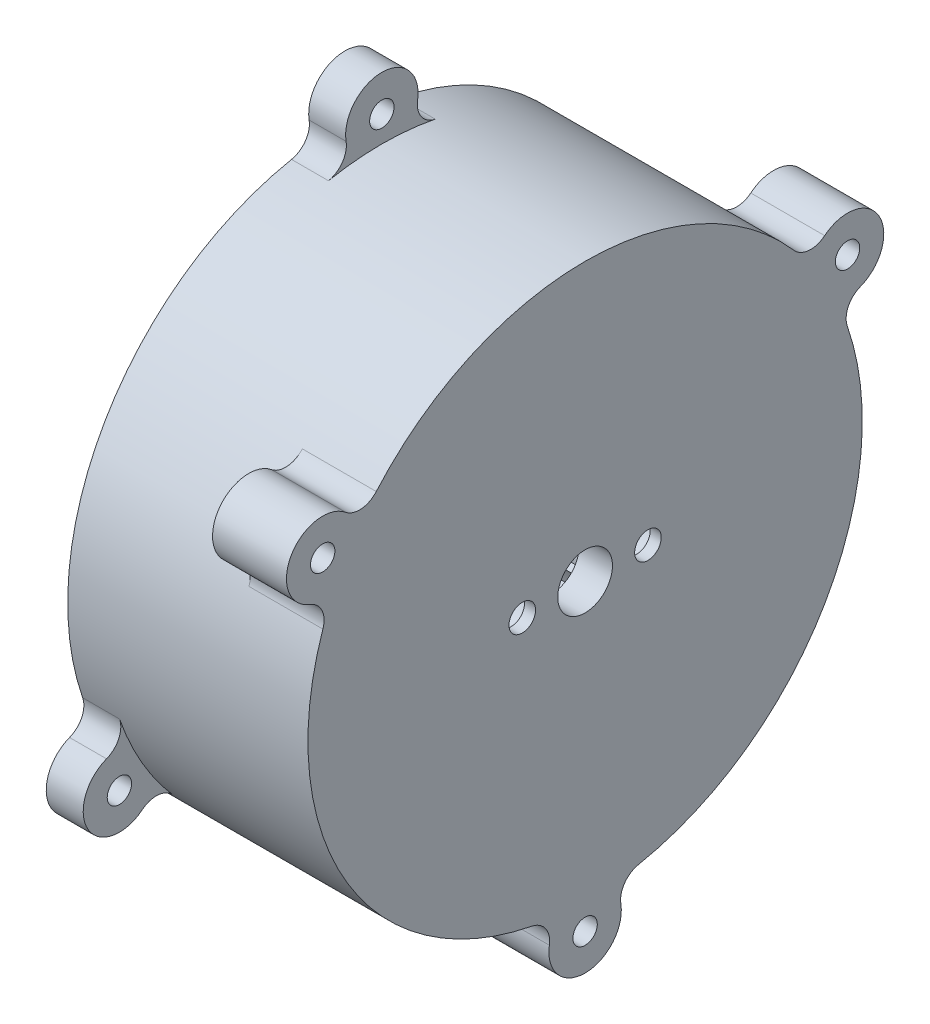
from build123d import *

# Parameters (mm, degrees)
BASPROSKE_W         = 28
BASPROSKE_H         = 4.375
TOOTHCUT_DEPTH      = 60.970826241
TEETHCUTS_COUNT     = 55
TEETHCUTS_ANGLE     = 353.454545455
BOSS_EXTRUDE1_START = 4.5
SKETCH1_R           = 37.5
BOSS_EXTRUDE1_DEPTH = 4.5
SKETCH2_R           = 3.7
SKETCH2_R_2         = 1.8
CUT_EXTRUDE1_DEPTH  = 4.5
SKETCH3_R           = 3.25
CUT_EXTRUDE2_DEPTH  = 3
BOSS_EXTRUDE2_START = -5
SKETCH4_R           = 1.65
BOSS_EXTRUDE2_DEPTH = 5
FILLET1_R           = 3
SKETCH5_R           = 1.65
BOSS_EXTRUDE3_DEPTH = 10
FILLET2_R           = 3


with BuildPart() as part:
    # BasProSke → Base-Revolve (revolve)
    with BuildSketch(Plane(origin=(0, 0, 0), x_dir=(1, 0, 0), z_dir=(0, 1, 0))):
        with Locations((14, 35.3125)):
            Rectangle(BASPROSKE_W, BASPROSKE_H)
    revolve(axis=Axis((-10, 0, 0), (1, 0, 0)))

    # TooCutSke → ToothCut (cut, through all)
    with BuildSketch(Plane(origin=(0, 0, 0), x_dir=(0, 0, -1), z_dir=(1, 0, 0))):
        with BuildLine():
            ThreePointArc((1.451447951, 33.067761022), (1.040603726, 34.522224287), (0.503573985, 35.934971761))
            ThreePointArc((0.503573985, 35.934971761), (0, 35.9385), (-0.503573985, 35.934971761))
            ThreePointArc((-0.503573985, 35.934971761), (-1.040603726, 34.522224287), (-1.451447951, 33.067761022))
            ThreePointArc((-1.451447951, 33.067761022), (0, 33.0996), (1.451447951, 33.067761022))
        make_face()
    toothcut = extrude(amount=TOOTHCUT_DEPTH, mode=Mode.SUBTRACT)

    # TeethCuts: ToothCut ×55 about axis
    teethcuts_axis = Axis((-10, 0, 0), (1, 0, 0))
    for i in range(1, TEETHCUTS_COUNT):
        add(toothcut.rotate(teethcuts_axis, i * TEETHCUTS_ANGLE / (TEETHCUTS_COUNT - 1)), mode=Mode.SUBTRACT)

    # Sketch1 → Boss-Extrude1 (add)
    with BuildSketch(Plane(origin=(28, 0, 0), x_dir=(0, 0, -1), z_dir=(1, 0, 0)).offset(BOSS_EXTRUDE1_START)):
        Circle(SKETCH1_R)
    extrude(amount=-BOSS_EXTRUDE1_DEPTH)

    # Sketch2 → Cut-Extrude1 (cut)
    with BuildSketch(Plane(origin=(32.5, 0, 0), x_dir=(0, 0, -1), z_dir=(1, 0, 0))):
        Circle(SKETCH2_R)
        with Locations((-8.5, 0)):
            Circle(SKETCH2_R_2)
        with Locations((8.5, 0)):
            Circle(SKETCH2_R_2)
    extrude(amount=-CUT_EXTRUDE1_DEPTH, mode=Mode.SUBTRACT)

    # Sketch3 → Cut-Extrude2 (cut)
    with BuildSketch(Plane.ZY.offset(-28)):
        with Locations((-8.5, 0)):
            Circle(SKETCH3_R)
        with Locations((8.5, 0)):
            Circle(SKETCH3_R)
    extrude(amount=-CUT_EXTRUDE2_DEPTH, mode=Mode.SUBTRACT)

    # Sketch4 → Boss-Extrude2 (add)
    # profile 1 of 3: a face of its own
    with BuildSketch(Plane.ZY.offset(BOSS_EXTRUDE2_START)):
        with BuildLine():
            ThreePointArc((-3.276511835, 37.356585366), (0, 45.9), (3.276511835, 37.356585366))
            ThreePointArc((3.276511835, 37.356585366), (0, 37.5), (-3.276511835, 37.356585366))
        make_face()
        with Locations((0, 41)):
            Circle(SKETCH4_R, mode=Mode.SUBTRACT)
    # profile 2 of 3: a face of its own
    with BuildSketch(Plane.ZY.offset(BOSS_EXTRUDE2_START)):
        with BuildLine():
            ThreePointArc((33.990007843, -15.840750198), (39.750566034, -22.95), (30.713496008, -21.515835168))
            ThreePointArc((30.713496008, -21.515835168), (32.475952642, -18.75), (33.990007843, -15.840750198))
        make_face()
        with Locations((35.507041555, -20.5)):
            Circle(SKETCH4_R, mode=Mode.SUBTRACT)
    # profile 3 of 3: a face of its own
    with BuildSketch(Plane.ZY.offset(BOSS_EXTRUDE2_START)):
        with BuildLine():
            ThreePointArc((-30.713496008, -21.515835168), (-39.750566034, -22.95), (-33.990007843, -15.840750198))
            ThreePointArc((-33.990007843, -15.840750198), (-32.475952642, -18.75), (-30.713496008, -21.515835168))
        make_face()
        with Locations((-35.507041555, -20.5)):
            Circle(SKETCH4_R, mode=Mode.SUBTRACT)
    extrude(amount=BOSS_EXTRUDE2_DEPTH)

    # Fillet1
    fillet1_edges = [part.edges().sort_by_distance(p)[0] for p in [
        (2.5, -21.515835168, -30.713496008),
        (2.5, -21.515835168, 30.713496008),
        (2.5, -15.840750198, 33.990007843),
        (2.5, 37.356585366, 3.276511835),
        (2.5, -15.840750198, -33.990007843),
        (2.5, 37.356585366, -3.276511835),
    ]]
    fillet(fillet1_edges, radius=FILLET1_R)

    # Sketch5 → Boss-Extrude3 (add)
    # profile 1 of 3: a face of its own
    with BuildSketch(Plane(origin=(32.5, 0, 0), x_dir=(0, 0, -1), z_dir=(1, 0, 0))):
        with BuildLine():
            ThreePointArc((33.990007843, 15.840750198), (39.750566034, 22.95), (30.713496008, 21.515835168))
            ThreePointArc((30.713496008, 21.515835168), (32.475952642, 18.75), (33.990007843, 15.840750198))
        make_face()
        with Locations((35.507041555, 20.5)):
            Circle(SKETCH5_R, mode=Mode.SUBTRACT)
    # profile 2 of 3: a face of its own
    with BuildSketch(Plane(origin=(32.5, 0, 0), x_dir=(0, 0, -1), z_dir=(1, 0, 0))):
        with BuildLine():
            ThreePointArc((-3.276511835, -37.356585366), (0, -45.9), (3.276511835, -37.356585366))
            ThreePointArc((3.276511835, -37.356585366), (0, -37.5), (-3.276511835, -37.356585366))
        make_face()
        with Locations((0, -41)):
            Circle(SKETCH5_R, mode=Mode.SUBTRACT)
    # profile 3 of 3: a face of its own
    with BuildSketch(Plane(origin=(32.5, 0, 0), x_dir=(0, 0, -1), z_dir=(1, 0, 0))):
        with BuildLine():
            ThreePointArc((-30.713496008, 21.515835168), (-39.750566034, 22.95), (-33.990007843, 15.840750198))
            ThreePointArc((-33.990007843, 15.840750198), (-32.475952642, 18.75), (-30.713496008, 21.515835168))
        make_face()
        with Locations((-35.507041555, 20.5)):
            Circle(SKETCH5_R, mode=Mode.SUBTRACT)
    extrude(amount=-BOSS_EXTRUDE3_DEPTH)

    # Fillet2
    fillet2_edges = [part.edges().sort_by_distance(p)[0] for p in [
        (27.5, 15.840750198, 33.990007843),
        (27.5, -37.356585366, 3.276511835),
        (27.5, -37.356585366, -3.276511835),
        (27.5, 21.515835168, 30.713496008),
        (27.5, 15.840750198, -33.990007843),
        (27.5, 21.515835168, -30.713496008),
    ]]
    fillet(fillet2_edges, radius=FILLET2_R)


solid = part.part
